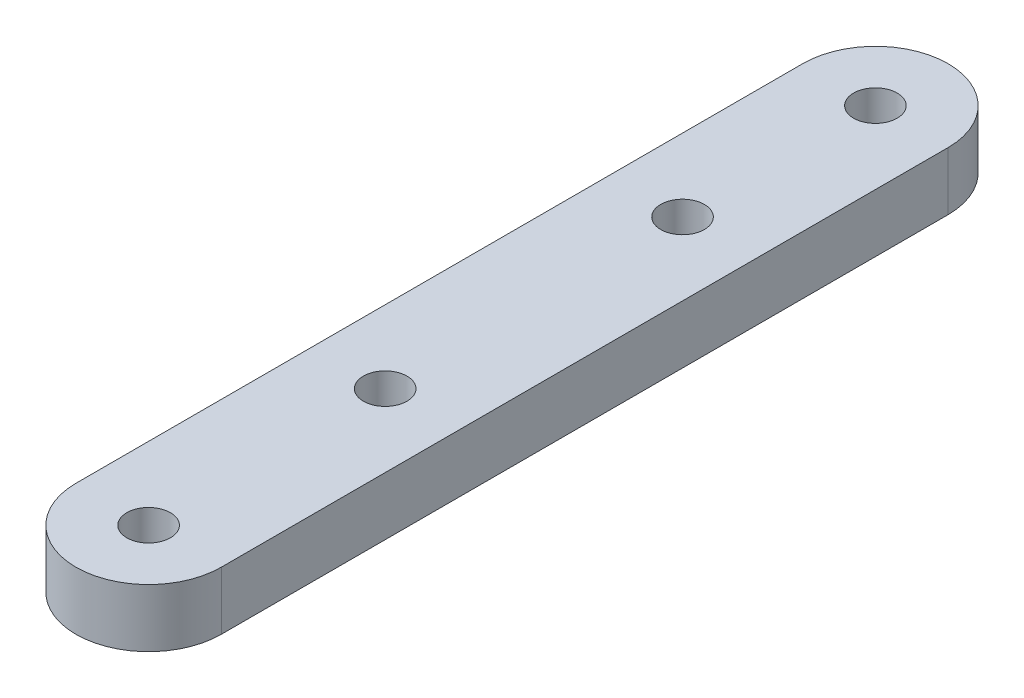
from build123d import *

# Parameters (mm, degrees)
SKETCH1_R           = 1.5
BOSS_EXTRUDE1_DEPTH = 4


with BuildPart() as part:
    # Sketch1 → Boss-Extrude1 (new body)
    with BuildSketch(Plane(origin=(0, 0, 0), x_dir=(1, 0, 0), z_dir=(0, 1, 0))):
        with BuildLine():
            ThreePointArc((5, 0), (0, 5), (-5, 0))
            Line((-5, 0), (-5, -50))
            ThreePointArc((-5, -50), (0, -55), (5, -50))
            Line((5, -50), (5, 0))
        make_face()
        with BuildLine():
            ThreePointArc((0, -48.5), (1.060660172, -48.939339828), (1.5, -50))
            ThreePointArc((1.5, -50), (-1.060660172, -51.060660172), (0, -48.5))
        make_face(mode=Mode.SUBTRACT)
        with Locations((0, -33.724539704)):
            Circle(SKETCH1_R, mode=Mode.SUBTRACT)
        with Locations((0, -13.267766632)):
            Circle(SKETCH1_R, mode=Mode.SUBTRACT)
        Circle(SKETCH1_R, mode=Mode.SUBTRACT)
    extrude(amount=BOSS_EXTRUDE1_DEPTH)


solid = part.part
